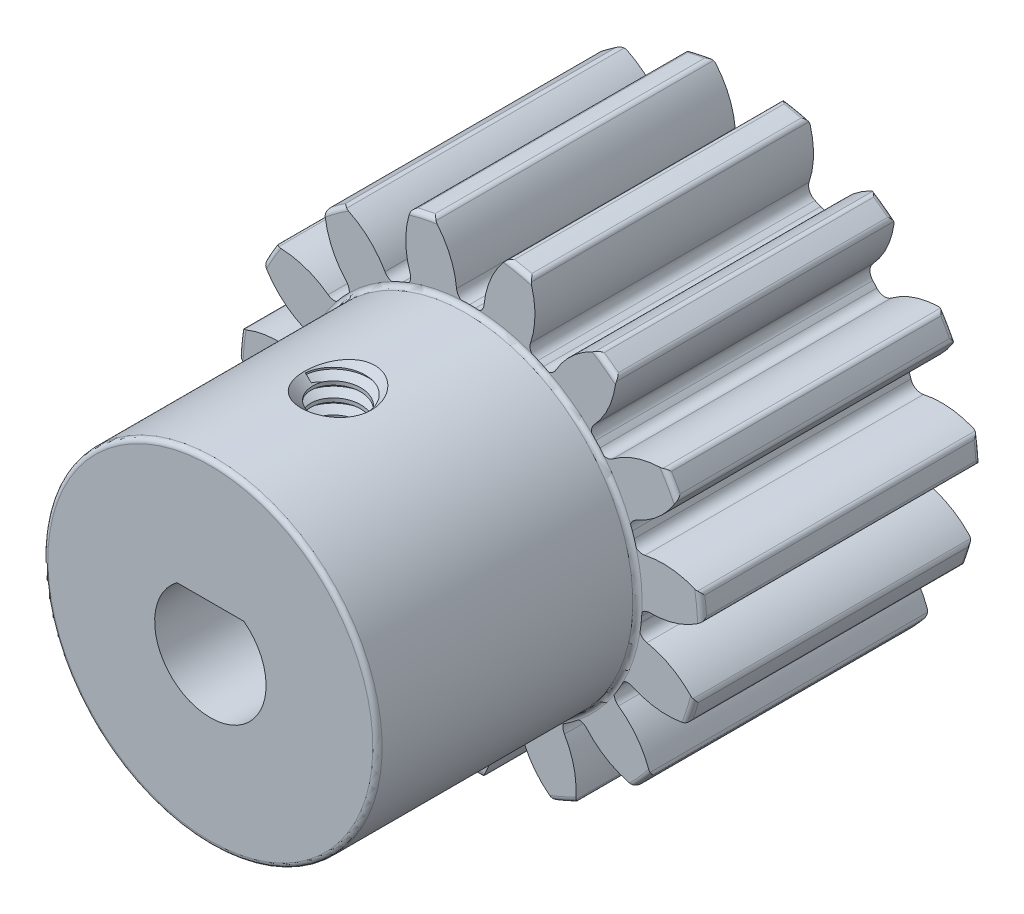
from build123d import *

# Parameters (mm, degrees)
FILLET2_R                = 0.25
CUT_EXTRUDE2_DEPTH       = 24.184046432
FILLET3_R                = 0.570000003
FILLET4_START            = -1
FILLET4_DEPTH            = 17
CIRPATTERN1_COUNT        = 15
FILLET3_OF_CIRPATTERN1_R = 0.570000003
CHAMFER1_SIZE            = 0.2
SKETCH8_R                = 6.35
BOSS_EXTRUDE1_DEPTH      = 29
THREAD1_PITCH            = 0.79375


with BuildPart() as part:
    # Sketch4 → Revolve1 (revolve)
    with BuildSketch(Plane(origin=(0, 0, 0), x_dir=(0, 0, -1), z_dir=(1, 0, 0))):
        Polygon((-29, 4.000000001), (-29, 9), (-15, 9), (-15, 12.500000019), (0, 12.500000019), (0, 4.000000001), align=None)
    revolve(axis=Axis((0, 0, 15), (0, 0, 1)))

    # Fillet2
    fillet2_edges = [part.edges().sort_by_distance(p)[0] for p in [
        (0, -12.500000019, 0),
        (0, -12.500000019, 15),
        (0, -9, 15),
        (0, -9, 29),
    ]]
    fillet(fillet2_edges, radius=FILLET2_R)

    # Sketch7 → Cut-Extrude2 (cut, through all)
    with BuildSketch(Plane.XY.offset(15)):
        with BuildLine():
            ThreePointArc((-1.9834579, 12.3416326), (0, 12.500000019), (1.9834579, 12.3416326))
            ThreePointArc((1.9834579, 12.3416326), (1.026198413, 10.845942869), (0.722099748, 9.09638364))
            ThreePointArc((0.722099748, 9.09638364), (0, 9.124999911), (-0.722099748, 9.09638364))
            ThreePointArc((-0.722099748, 9.09638364), (-1.026198413, 10.845942869), (-1.9834579, 12.3416326))
        make_face()
    cut_extrude2 = extrude(amount=-CUT_EXTRUDE2_DEPTH, mode=Mode.SUBTRACT)

    # Fillet3
    # the kernel refuses this fillet: 0.570000003 mm, written as the material it adds along each edge
    with BuildSketch(Plane(origin=(-0.722099748, 9.09638364, 15), x_dir=(-0.03392009793379865, 0.9994245479055243, 0), z_dir=(0, 0, -1))) as fillet3_piece_1:
        with BuildLine():
            CenterArc((0.578104765, 0.568959051), FILLET3_R, 180.920938922, 85.615827923)
            ThreePointArc((0.008178392, 0.559797598), (0.00838345, 0.279836062), (0, 0))
            ThreePointArc((0, 0), (0.271836096, 0.008218044), (0.543672193, 0))
        make_face()
    extrude(amount=15)
    with BuildSketch(Plane(origin=(0.722099748, 9.09638364, 15), x_dir=(-0.9988224023674557, 0.04851606464774499, 0), z_dir=(0, 0, -1))) as fillet3_piece_2:
        with BuildLine():
            CenterArc((0.577343291, 0.569731731), FILLET3_R, 182.62622708, 85.615827923)
            ThreePointArc((0.007941959, 0.543614182), (0.012188147, 0.271687042), (0, 0))
            ThreePointArc((0, 0), (0.279928668, 0.004294713), (0.559857336, 0))
        make_face()
    extrude(amount=15)

    # Fillet4: read off the stored shape, not the designer's step
    # Fillet4 outline → Fillet4 (cut)
    with BuildSketch(Plane.XY.offset(FILLET4_START)):
        with BuildLine():
            ThreePointArc((-1.9834579, 12.3416326), (-2.059852701, 12.329112187), (-2.136168497, 12.316118895))
            ThreePointArc((-2.136168497, 12.316118895), (-1.994266882, 12.304642638), (-1.875620362, 12.225961154))
            ThreePointArc((-1.875620362, 12.225961154), (-1.929033114, 12.284272928), (-1.9834579, 12.3416326))
        make_face()
        with BuildLine():
            ThreePointArc((1.875620362, 12.225961154), (1.994266882, 12.304642638), (2.136168497, 12.316118895))
            ThreePointArc((2.136168497, 12.316118895), (2.059852701, 12.329112187), (1.9834579, 12.3416326))
            ThreePointArc((1.9834579, 12.3416326), (1.929033114, 12.284272928), (1.875620362, 12.225961154))
        make_face()
    fillet4 = extrude(amount=FILLET4_DEPTH, mode=Mode.SUBTRACT)

    # CirPattern1: Cut-Extrude2, Fillet4 ×15 about axis
    cirpattern1_axis = Axis((0, 0, 0), (0, 0, 1))
    add([cut_extrude2.rotate(cirpattern1_axis, i * 360 / CIRPATTERN1_COUNT) for i in range(1, CIRPATTERN1_COUNT)], mode=Mode.SUBTRACT)
    add([fillet4.rotate(cirpattern1_axis, i * 360 / CIRPATTERN1_COUNT) for i in range(1, CIRPATTERN1_COUNT)], mode=Mode.SUBTRACT)

    # Fillet3 of CirPattern1
    # the kernel refuses this fillet: 0.570000003 mm, written as the material it adds along each edge
    with BuildSketch(Plane(origin=(-4.35950349, 8.016255528, 15), x_dir=(-0.43749013701285194, 0.899223209229208, 0), z_dir=(0, 0, -1)), Plane(origin=(-7.243109475, 5.55004401, 15), x_dir=(-0.7654141569292694, 0.6435380084907618, 0), z_dir=(0, 0, -1)), Plane(origin=(-8.874316029, 2.124179462, 15), x_dir=(-0.9609911155432924, 0.2765792397249987, 0), z_dir=(0, 0, -1)), Plane(origin=(-8.971072722, -1.668975013, 15), x_dir=(-0.9904039799496734, -0.1382025922327325, 0), z_dir=(0, 0, -1)), Plane(origin=(-7.516649441, -5.173548546, 15), x_dir=(-0.8485669986850637, -0.5290879404622857, 0), z_dir=(0, 0, -1)), Plane(origin=(-4.762529185, -7.783568535, 15), x_dir=(-0.5600050743586338, -0.8284891771728711, 0), z_dir=(0, 0, -1)), Plane(origin=(-1.184924367, -9.047738813, 15), x_dir=(-0.17461318518921154, -0.984637108562377, 0), z_dir=(0, 0, -1)), Plane(origin=(2.597564639, -8.747472854, 15), x_dir=(0.2409709100104134, -0.9705323387341367, 0), z_dir=(0, 0, -1)), Plane(origin=(5.93091112, -6.93468937, 15), x_dir=(0.6148889457172445, -0.7886137105292651, 0), z_dir=(0, 0, -1)), Plane(origin=(8.238749189, -3.922835095, 15), x_dir=(0.8824870966188602, -0.470336607443238, 0), z_dir=(0, 0, -1)), Plane(origin=(9.122032676, -0.232686994, 15), x_dir=(0.99749521137149, -0.07073403205633463, 0), z_dir=(0, 0, -1)), Plane(origin=(8.428033842, 3.497694803, 15), x_dir=(0.9400273421184806, 0.34109910007161387, 0), z_dir=(0, 0, -1)), Plane(origin=(6.276751391, 6.623293392, 15), x_dir=(0.7200202055328812, 0.6939530990091388, 0), z_dir=(0, 0, -1)), Plane(origin=(3.040161602, 8.603664383, 15), x_dir=(0.37551503423243077, 0.9268163027619963, 0), z_dir=(0, 0, -1))) as fillet3_of_cirpattern1_piece_1:
        with BuildLine():
            CenterArc((0.578104765, 0.568959051), FILLET3_OF_CIRPATTERN1_R, 180.920938922, 85.615827923)
            ThreePointArc((0.008178392, 0.559797598), (0.00838345, 0.279836062), (0, 0))
            ThreePointArc((0, 0), (0.271836096, 0.008218044), (0.543672193, 0))
        make_face()
    extrude(amount=15)
    with BuildSketch(Plane(origin=(-3.040161602, 8.603664383, 15), x_dir=(-0.9322029299445312, -0.36193604048620415, 0), z_dir=(0, 0, -1)), Plane(origin=(-6.276751391, 6.623293392, 15), x_dir=(-0.7043971021364471, -0.709806116134382, 0), z_dir=(0, 0, -1)), Plane(origin=(-8.428033842, 3.497694803, 15), x_dir=(-0.3547946161221937, -0.9349442659168007, 0), z_dir=(0, 0, -1)), Plane(origin=(-9.122032676, -0.232686994, 15), x_dir=(0.056155082227490286, -0.9984220584201973, 0), z_dir=(0, 0, -1)), Plane(origin=(-8.238749189, -3.922835095, 15), x_dir=(0.45739505670713304, -0.8892636066430913, 0), z_dir=(0, 0, -1)), Plane(origin=(-5.93091112, -6.93468937, 15), x_dir=(0.7795472705784721, -0.6263433985711466, 0), z_dir=(0, 0, -1)), Plane(origin=(-2.597564639, -8.747472854, 15), x_dir=(0.9669086794021665, -0.2551227267351113, 0), z_dir=(0, 0, -1)), Plane(origin=(1.184924367, -9.047738813, 15), x_dir=(0.987082793467639, 0.16021098227063638, 0), z_dir=(0, 0, -1)), Plane(origin=(4.762529185, -7.783568535, 15), x_dir=(0.8365813251768964, 0.5478427569707096, 0), z_dir=(0, 0, -1)), Plane(origin=(7.516649441, -5.173548546, 15), x_dir=(0.5414273456603235, 0.8407475419953464, 0), z_dir=(0, 0, -1)), Plane(origin=(8.971072722, -1.668975013, 15), x_dir=(0.1526556593660622, 0.9882794390573514, 0), z_dir=(0, 0, -1)), Plane(origin=(8.874316029, 2.124179462, 15), x_dir=(-0.26251157726571966, 0.9649288428694958, 0), z_dir=(0, 0, -1)), Plane(origin=(7.243109475, 5.55004401, 15), x_dir=(-0.6322881773454451, 0.7747332836461689, 0), z_dir=(0, 0, -1)), Plane(origin=(4.35950349, 8.016255528, 15), x_dir=(-0.8927364074043882, 0.45057930144948527, 0), z_dir=(0, 0, -1))) as fillet3_of_cirpattern1_piece_2:
        with BuildLine():
            CenterArc((0.577343291, 0.569731731), FILLET3_OF_CIRPATTERN1_R, 182.62622708, 85.615827923)
            ThreePointArc((0.007941959, 0.543614182), (0.012188147, 0.271687042), (0, 0))
            ThreePointArc((0, 0), (0.279928668, 0.004294713), (0.559857336, 0))
        make_face()
    extrude(amount=15)

    # Chamfer1
    chamfer1_edges = [part.edges().sort_by_distance(p)[0] for p in [
        (0, -4.000000001, 0),
        (0, -4.000000001, 29),
    ]]
    chamfer(chamfer1_edges, length=CHAMFER1_SIZE)

    # Sketch8 → Boss-Extrude1 (add)
    with BuildSketch(Plane.XY.offset(29)):
        Circle(SKETCH8_R)
        with BuildLine():
            Line((-1.8, 2.4), (1.8, 2.4))
            ThreePointArc((1.8, 2.4), (0, -3), (-1.8, 2.4))
        make_face(mode=Mode.SUBTRACT)
    extrude(amount=-BOSS_EXTRUDE1_DEPTH)

    # Sketch10 → Tap Drill for #6-32 Tap1 (revolve, cut)
    with BuildSketch(Plane(origin=(0, 9, 22.125), x_dir=(0, 0, 1), z_dir=(1, 0, 0))):
        Polygon((0, 0), (0, 6.601), (1.35255, 6.601), (1.35255, 0.635), (1.98755, 0), align=None)
    revolve(axis=Axis((0, 15.35, 22.125), (0, -1, 0)), mode=Mode.SUBTRACT)

    # Thread1: arcs per turn and ends read off the stored shape
    # Thread1: the profile of Thread Profile2 profile screwed along a right-hand helix through 12.598425 turns, 8 arcs to a turn; built about Z, then put on its axis
    thread1_z = Axis((0, 0, 0), (0, 0, 1))
    thread1_corners = [(1.35225, 0, -0.000173205), (1.782179788, 0, 0.248046874), (1.782179788, 0, 0.347265624), (1.35225, 0, 0.595485703)]
    with BuildLine(mode=Mode.PRIVATE) as thread1_profile:
        Line(thread1_corners[0], thread1_corners[1])
        Line(thread1_corners[1], thread1_corners[2])
        Line(thread1_corners[2], thread1_corners[3])
        Line(thread1_corners[3], thread1_corners[0])
    thread1_cap = Face(thread1_profile.wire())
    thread1_turn_angles = [0, 22.5, 45, 67.5, 90, 112.5, 135, 157.5, 180, 202.5, 225, 247.5, 270, 292.5, 315, 337.5, 360]
    thread1_turn_weights = [1, 0.9238795325112867, 1, 0.9238795325112867, 1, 0.9238795325112867, 1, 0.9238795325112867, 1, 0.9238795325112867, 1, 0.9238795325112867, 1, 0.9238795325112867, 1, 0.9238795325112867, 1]
    thread1_turn_rails = [Edge.make_bspline([Vector(p[0], p[1], 0).rotate(thread1_z, thread1_turn_angles[k]) / thread1_turn_weights[k] + Vector(0, 0, p[2] + THREAD1_PITCH * thread1_turn_angles[k] / 360) for k in range(17)], [0, 0, 0, 1, 1, 2, 2, 3, 3, 4, 4, 5, 5, 6, 6, 7, 7, 8, 8, 8], 2, thread1_turn_weights) for p in thread1_corners]
    thread1_turn_sides = [Face.make_surface_from_curves(thread1_turn_rails[p[0]], thread1_turn_rails[p[1]]) for p in [(0, 1), (1, 2), (2, 3), (3, 0)]]
    thread1_last_angles = [4320, 4342.5, 4365, 4387.5, 4410, 4432.5, 4455, 4477.5, 4500, 4517.716535433, 4535.433070866]
    thread1_last_weights = [1, 0.9238795325112867, 1, 0.9238795325112867, 1, 0.9238795325112867, 1, 0.9238795325112867, 1, 0.9525736983244454, 1]
    thread1_last_rails = [Edge.make_bspline([Vector(p[0], p[1], 0).rotate(thread1_z, thread1_last_angles[k]) / thread1_last_weights[k] + Vector(0, 0, p[2] + THREAD1_PITCH * thread1_last_angles[k] / 360) for k in range(11)], [0, 0, 0, 1, 1, 2, 2, 3, 3, 4, 4, 5, 5, 5], 2, thread1_last_weights) for p in thread1_corners]
    thread1_last_sides = [Face.make_surface_from_curves(thread1_last_rails[p[0]], thread1_last_rails[p[1]]) for p in [(0, 1), (1, 2), (2, 3), (3, 0)]]
    thread1 = Plane(origin=(0, 9, 22.125), x_dir=(-1, 0, 0), z_dir=(0, -1, 0)) * Solid(Shell([*[p.moved(Location((0, 0, THREAD1_PITCH * i))) for i in range(12) for p in thread1_turn_sides], *thread1_last_sides, thread1_cap, thread1_cap.rotate(thread1_z, 4535.433070866).moved(Location((0, 0, THREAD1_PITCH * 4535.433070866 / 360)))]))
    add(thread1, mode=Mode.SUBTRACT)


solid = part.part
